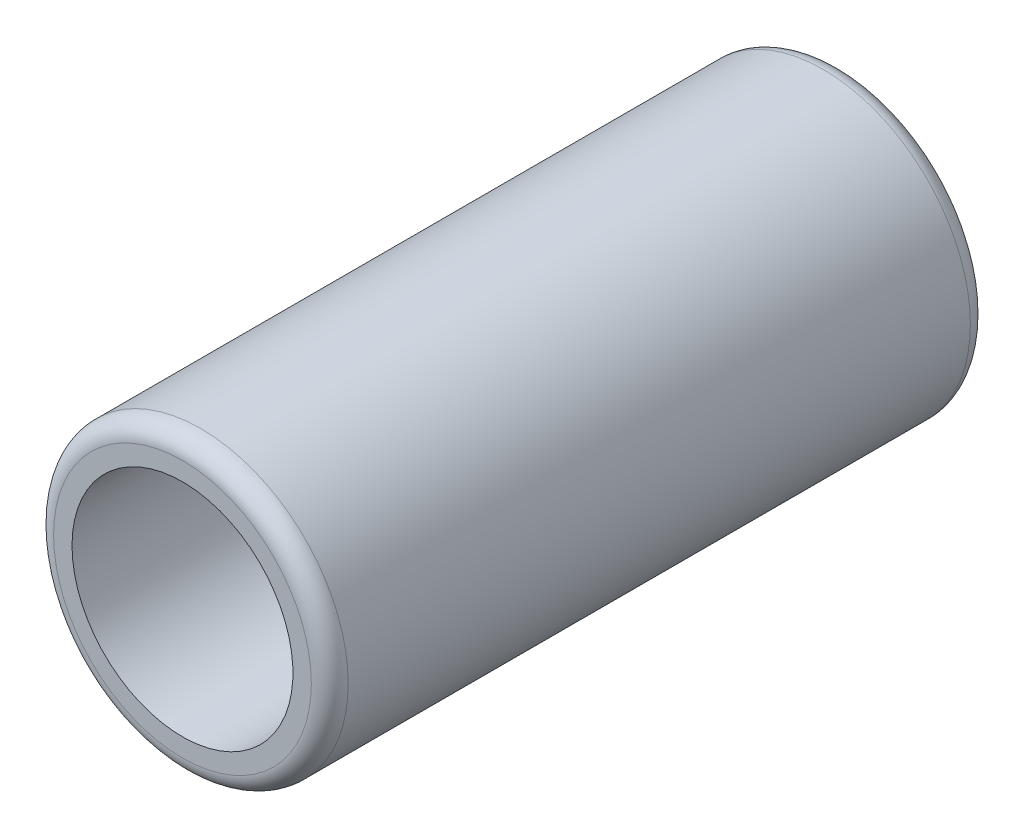
from build123d import *

# Parameters (mm, degrees)
SKETCH1_R           = 4
SKETCH1_R_2         = 3
BOSS_EXTRUDE1_DEPTH = 17.9
FILLET1_R           = 0.5


with BuildPart() as part:
    # Sketch1 → Boss-Extrude1 (new body)
    with BuildSketch(Plane.XY):
        Circle(SKETCH1_R)
        Circle(SKETCH1_R_2, mode=Mode.SUBTRACT)
    extrude(amount=BOSS_EXTRUDE1_DEPTH)

    # Fillet1
    fillet1_edges = [part.edges().sort_by_distance(p)[0] for p in [
        (-4, 0, 0),
        (-4, 0, 17.9),
    ]]
    fillet(fillet1_edges, radius=FILLET1_R)


solid = part.part
